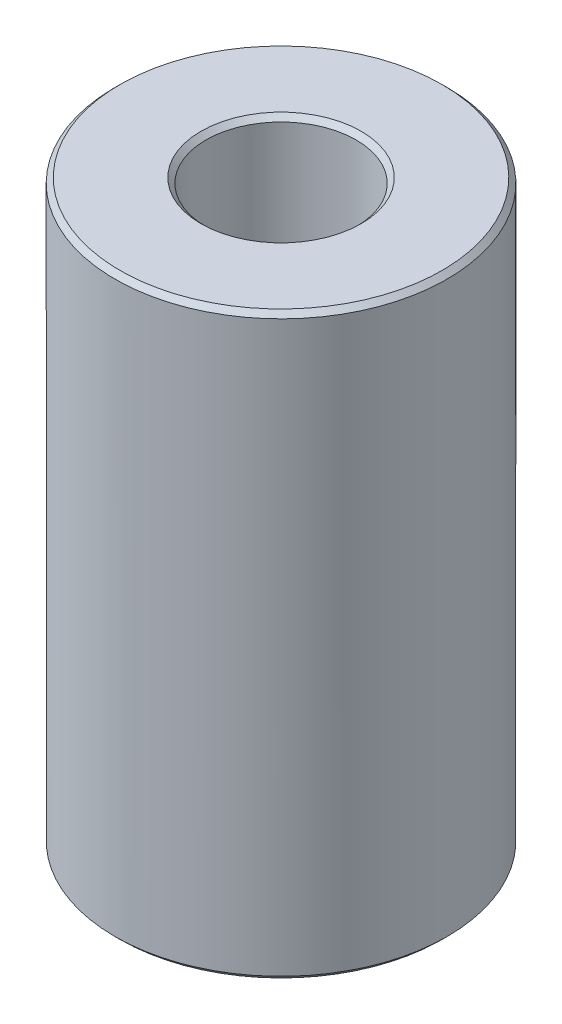
from build123d import *

# Parameters (mm, degrees)
SKETCH1_R           = 22.5
BOSS_EXTRUDE1_DEPTH = 78.500701833
SKETCH2_R           = 10.17575938
CUT_EXTRUDE1_DEPTH  = 85.704546444
CHAMFER1_SIZE       = 0.679007585


with BuildPart() as part:
    # Sketch1 → Boss-Extrude1 (new body)
    with BuildSketch(Plane(origin=(0, 0, 0), x_dir=(1, 0, 0), z_dir=(0, 1, 0))):
        Circle(SKETCH1_R)
    extrude(amount=BOSS_EXTRUDE1_DEPTH)

    # Sketch2 → Cut-Extrude1 (cut, through all)
    with BuildSketch(Plane(origin=(0, 0, 0), x_dir=(1, 0, 0), z_dir=(0, 1, 0))):
        Circle(SKETCH2_R)
    extrude(amount=CUT_EXTRUDE1_DEPTH, mode=Mode.SUBTRACT)

    # Chamfer1
    chamfer1_edges = [part.edges().sort_by_distance(p)[0] for p in [
        (-10.17575938, 78.500701833, 0),
        (-10.17575938, 0, 0),
        (-22.5, 0, 0),
        (-22.5, 78.500701833, 0),
    ]]
    chamfer(chamfer1_edges, length=CHAMFER1_SIZE)


solid = part.part
